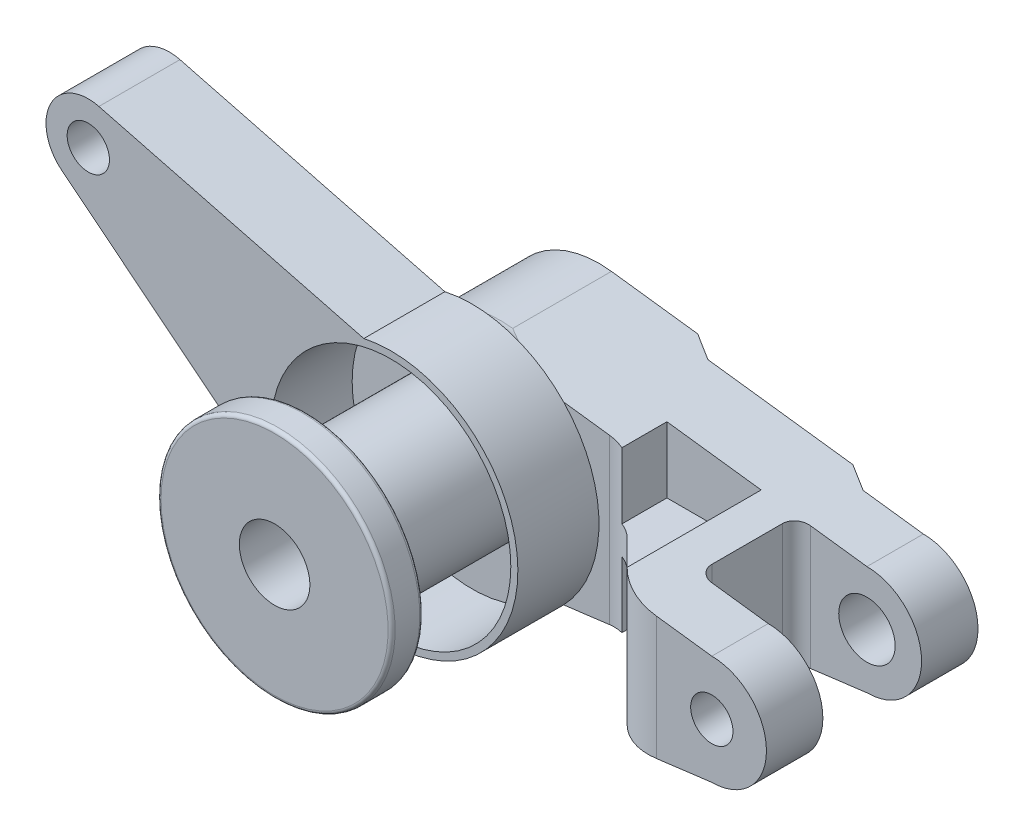
from build123d import *

# Parameters (mm, degrees)
SKETCH1_R                = 7
SKETCH1_R_2              = 3.5
CYLINDER_DEPTH           = 22.85
SKETCH2_R                = 4
BORE_1_DEPTH             = 3.25
BORE_START               = -3.25
SKETCH3_R                = 4
BORE_2_DEPTH             = 3.25
ARM_DEPTH                = 17
SKETCH5_R                = 3.5
OUTER_HOLE_SURFACE_DEPTH = 6
SKETCH6_R                = 1.125
OUTER_HOLE_DEPTH         = 6
SIDE_FEATURES_DEPTH      = 22
RIB_START                = -11
SKETCH10_W               = 6.681980515
SKETCH10_H               = 4.679772507
RIB_DEPTH                = 9.5
SKETCH13_R               = 1.5
BOTTOM_HOLE_DEPTH        = 4
MODIFY_START             = -17
SKETCH14_W               = 14
SKETCH14_H               = 13.85
MODIFY_1ST_POST_DEPTH    = 14
SKETCH16_R               = 8.5
SKETCH16_R_2             = 1.5
ARM_2_DEPTH              = 5.75


# Read off the part's stored shape, not the designer's step: Top Counter-sunk
with BuildPart() as part:
    # Sketch1 → Cylinder (new body)
    with BuildSketch(Plane.XY):
        with Locations(Location((0, 0, 0), (0, 0, 180))):
            Circle(SKETCH1_R)
        with Locations(Location((0, 0, 0), (0, 0, 180))):
            Circle(SKETCH1_R_2, mode=Mode.SUBTRACT)
    extrude(amount=CYLINDER_DEPTH)

    # Sketch2 → Bore 1 (cut)
    with BuildSketch(Plane.XY.offset(22.85)):
        Circle(SKETCH2_R)
    extrude(amount=-BORE_1_DEPTH, mode=Mode.SUBTRACT)

    # Sketch3 → Bore 2 (cut)
    with BuildSketch(Plane(origin=(0, 0, 0), x_dir=(-1, 0, 0), z_dir=(0, 0, -1)).offset(BORE_START)):
        with Locations(Location((0, 0, 0), (0, 0, 180))):
            Circle(SKETCH3_R)
    extrude(amount=BORE_2_DEPTH, mode=Mode.SUBTRACT)

    # Sketch4 → Arm (add)
    with BuildSketch(Plane.XY):
        with BuildLine():
            Line((0.8836803, 6.943998065), (25, 3.875))
            ThreePointArc((25, 3.875), (28.875, 0), (25, -3.875))
            Line((25, -3.875), (0.8836803, -6.943998065))
            ThreePointArc((0.8836803, -6.943998065), (7, 0), (0.8836803, 6.943998065))
        make_face()
    extrude(amount=ARM_DEPTH)

    # Sketch5 → Outer Hole surface (add)
    with BuildSketch(Plane(origin=(0, 0, 0), x_dir=(-1, 0, 0), z_dir=(0, 0, -1))):
        with Locations((-14, -6)):
            Circle(SKETCH5_R)
    extrude(amount=-OUTER_HOLE_SURFACE_DEPTH)

    # Sketch6 → Outer hole (cut)
    with BuildSketch(Plane(origin=(0, 0, 0), x_dir=(-1, 0, 0), z_dir=(0, 0, -1))):
        with Locations((-14, -6)):
            Circle(SKETCH6_R)
    extrude(amount=-OUTER_HOLE_DEPTH, mode=Mode.SUBTRACT)

    # Sketch8 → side Features (cut)
    with BuildSketch(Plane(origin=(0, 10, 0), x_dir=(1, 0, 0), z_dir=(0, 1, 0))):
        with BuildLine():
            Line((21, -6), (40, -6))
            Line((40, -6), (40, -13))
            Line((40, -13), (21, -13))
            ThreePointArc((21, -13), (20.292893219, -12.707106781), (20, -12))
            Line((20, -12), (20, -7))
            ThreePointArc((20, -7), (20.292893219, -6.292893219), (21, -6))
        make_face()
        with BuildLine():
            Line((7, -19), (7, -9))
            Line((7, -9), (9.757359313, -9))
            ThreePointArc((9.757359313, -9), (10.90540961, -9.228361402), (11.878679656, -9.878679656))
            Line((11.878679656, -9.878679656), (17.535533906, -15.535533906))
            ThreePointArc((17.535533906, -15.535533906), (19.15765065, -16.619397663), (21.071067812, -17))
            Line((21.071067812, -17), (27, -17))
            Line((27, -17), (27, -19))
            Line((27, -19), (7, -19))
        make_face()
        Polygon((7, 0), (8.732050808, -1), (19, -1), (20.732050808, -2), (40, -2), (40, 0), align=None)
    extrude(amount=-SIDE_FEATURES_DEPTH, mode=Mode.SUBTRACT)

    # Sketch10 → Rib (cut)
    with BuildSketch(Plane.XY.offset(17).offset(RIB_START)):
        with Locations((14.159009743, 3.339886254)):
            Rectangle(SKETCH10_W, SKETCH10_H)
        with Locations((14.159009743, -3.339886254)):
            Rectangle(SKETCH10_W, SKETCH10_H)
    extrude(amount=RIB_DEPTH, mode=Mode.SUBTRACT)

    # Top Counter-sunk outline → Top Counter-sunk (revolve, cut)
    with BuildSketch(Plane(origin=(25, 0, 0), x_dir=(1, 0, 0), z_dir=(0, -1, 0))):
        Polygon((2, 3.150368407), (2, 6), (0, 6), (0, 2), (3, 2), align=None)
    revolve(axis=Axis((25, 0, 0), (0, 0, 1)), mode=Mode.SUBTRACT)

    # Sketch13 → Bottom hole (cut)
    with BuildSketch(Plane.XY.offset(17)):
        with Locations((25, 0)):
            Circle(SKETCH13_R)
    extrude(amount=-BOTTOM_HOLE_DEPTH, mode=Mode.SUBTRACT)

    # Sketch14 → Modify 1st Post (cut)
    with BuildSketch(Plane(origin=(0, 10, 0), x_dir=(1, 0, 0), z_dir=(0, 1, 0)).offset(MODIFY_START)):
        with Locations((0, -15.925)):
            Rectangle(SKETCH14_W, SKETCH14_H)
    extrude(amount=MODIFY_1ST_POST_DEPTH, mode=Mode.SUBTRACT)

    # Sketch16 → Arm 2 (add)
    with BuildSketch(Plane.XY.offset(9)):
        with BuildLine():
            Line((-1.923786579, 8.791987557), (-20.708474673, 13.650638528))
            ThreePointArc((-20.708474673, 13.650638528), (-24.142164395, 12.089495372), (-23.335359521, 8.404870702))
            Line((-23.335359521, 8.404870702), (-8.192413809, -3.726171759))
            ThreePointArc((-8.192413809, -3.726171759), (8.047388132, -4.029831791), (-1.923786579, 8.791987557))
        make_face()
        with Locations(Location((0, 0, 0), (0, 0, 48.187305897))):
            Circle(SKETCH16_R, mode=Mode.SUBTRACT)
        with Locations((-21.459701684, 10.746218108)):
            Circle(SKETCH16_R_2, mode=Mode.SUBTRACT)
    extrude(amount=ARM_2_DEPTH)

    # Sketch18 → Connect Arm 2 (revolve)
    with BuildSketch(Plane(origin=(0, 0, 0), x_dir=(1, 0, 0), z_dir=(0, 1, 0))):
        with BuildLine():
            Line((-7, -7), (-7, -9))
            Line((-7, -9), (-9, -9))
            ThreePointArc((-9, -9), (-7.585786438, -8.414213562), (-7, -7))
        make_face()
    revolve(axis=Axis((0, 0, -2.563667384), (0, 0, 1)))


with BuildPart() as body_2:
    # Sketch19 → Base (revolve)
    with BuildSketch(Plane(origin=(0, 0, 0), x_dir=(1, 0, 0), z_dir=(0, 1, 0))):
        with BuildLine():
            Line((-4.9, -9), (-4.9, -20.5))
            ThreePointArc((-4.9, -20.5), (-4.973223305, -20.676776695), (-5.15, -20.75))
            Line((-5.15, -20.75), (-8.05, -20.75))
            ThreePointArc((-8.05, -20.75), (-8.226776695, -20.823223305), (-8.3, -21))
            Line((-8.3, -21), (-8.3, -22.75))
            ThreePointArc((-8.3, -22.75), (-8.226776695, -22.926776695), (-8.05, -23))
            Line((-8.05, -23), (-2.5, -23))
            Line((-2.5, -23), (-2.5, -9))
            Line((-2.5, -9), (-4.9, -9))
        make_face()
    revolve(axis=Axis((0, 0, -4.336156577), (0, 0, 1)))


solid = Compound([part.part, body_2.part])
